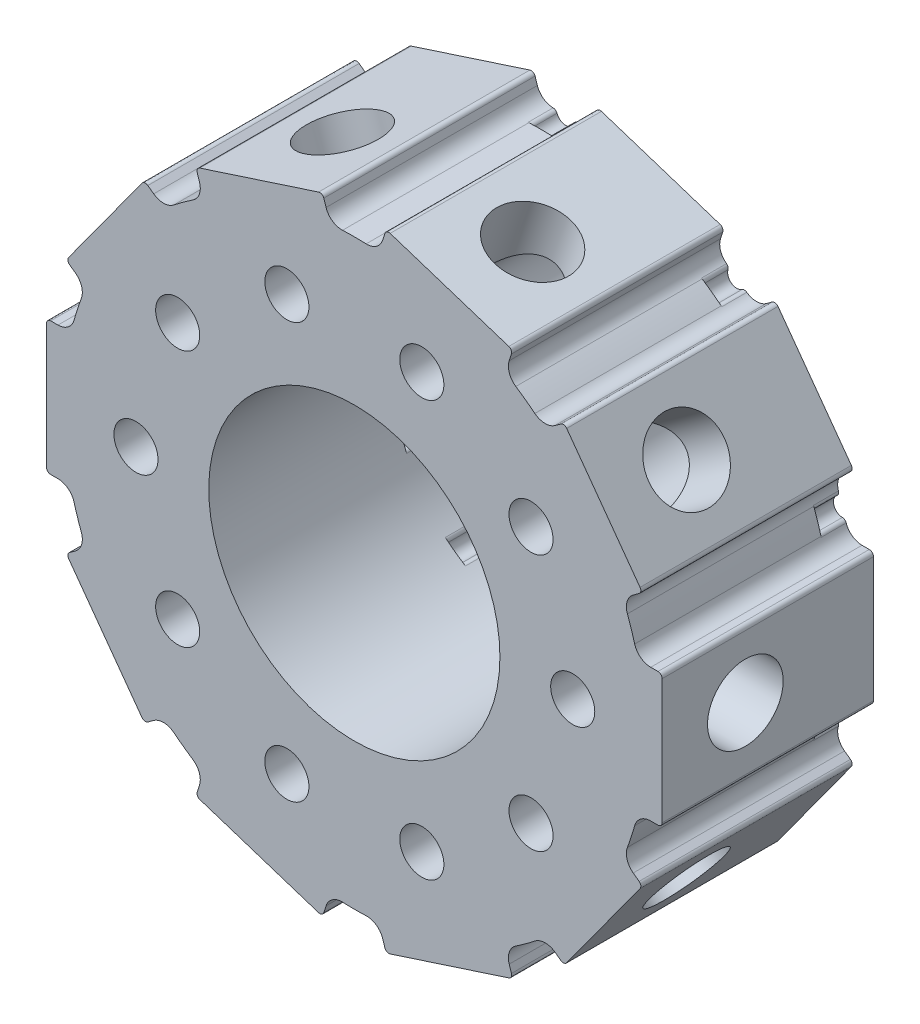
from build123d import *

# Parameters (mm, degrees)
SKETCH1_R                = 35
SKETCH1_R_2              = 17.5
BOSS_EXTRUDE1_DEPTH      = 25.4
M5_CLEARANCE_HOLE1_D     = 5.3
BOSS_EXTRUDE2_REACH      = 85.989
BOSS_EXTRUDE2_END_RADIUS = 35
SKETCH8_W                = 25.4
SKETCH8_H                = 16
FILLET3_R                = 2
FILLET4_R                = 0.5
CIRPATTERN3_COUNT        = 10
FILLET3_OF_CIRPATTERN3_R = 2
FILLET4_OF_CIRPATTERN3_R = 0.5
SKETCH9_R                = 1.1
CUT_EXTRUDE2_DEPTH       = 3
CIRPATTERN2_COUNT        = 10
FILLET1_R                = 0.5


with BuildPart() as part:
    # Sketch1 → Boss-Extrude1 (new body)
    with BuildSketch(Plane.XY):
        Circle(SKETCH1_R)
        Circle(SKETCH1_R_2, mode=Mode.SUBTRACT)
    extrude(amount=BOSS_EXTRUDE1_DEPTH)

    # M5 Clearance Hole1 (through all)
    with Locations(Plane.XY.offset(25.4)):
        with Locations((26.25, 0)):
            m5_clearance_hole1 = Hole(M5_CLEARANCE_HOLE1_D / 2)

    # Boss-Extrude2: up to this cylinder (the profile starts outside it)
    boss_extrude2_end = Plane(origin=(0, 0, 12.7), z_dir=(0, 0, -1)) * Cylinder(BOSS_EXTRUDE2_END_RADIUS, 242.978, mode=Mode.PRIVATE)
    # Sketch8 → Boss-Extrude2 (add, up to the surface)
    with BuildSketch(Plane(origin=(37, 0, 0), x_dir=(0, 0, -1), z_dir=(1, 0, 0)), mode=Mode.PRIVATE) as boss_extrude2_sk1:
        with Locations((-12.7, 0)):
            Rectangle(SKETCH8_W, SKETCH8_H)
    boss_extrude2_tool1 = extrude(boss_extrude2_sk1.sketch, amount=-BOSS_EXTRUDE2_REACH, mode=Mode.PRIVATE) - boss_extrude2_end
    boss_extrude2 = boss_extrude2_tool1.solids().sort_by_distance((37, 0, 12.7))[0]
    add(boss_extrude2)

    # Fillet3
    fillet3_edges = [part.edges().sort_by_distance(p)[0] for p in [
        (34.073450075, -8, 12.7),
        (34.073450075, 8, 12.7),
    ]]
    fillet(fillet3_edges, radius=FILLET3_R)

    # Fillet4
    fillet4_edges = [part.edges().sort_by_distance(p)[0] for p in [
        (37, -8, 12.7),
        (37, 8, 12.7),
    ]]
    fillet(fillet4_edges, radius=FILLET4_R)

    # Sketch11 → 1/8-27 NPSM Tapped Hole1 (revolve, cut)
    with BuildSketch(Plane(origin=(37, 0, 15.4), x_dir=(0, 0, -1), z_dir=(0, 1, 0))):
        Polygon((0, 0), (0, 12.73187289), (4.5466, 10), (4.5466, 0), align=None)
    f_1_8_27_npsm_tapped_hole1 = revolve(axis=Axis((43.35, 0, 15.4), (-1, 0, 0)), mode=Mode.SUBTRACT)

    # Sketch7 → Ø10.0mm Dowel Hole1 (revolve, cut)
    with BuildSketch(Plane.YZ.offset(26.25)):
        Polygon((0, 0), (0, 21.004303095), (5, 18), (5, 0), align=None)
    f_10_0mm_dowel_hole1 = revolve(axis=Axis((26.25, 0, -6.35), (0, 0, 1)), mode=Mode.SUBTRACT)

    # CirPattern3: M5 Clearance Hole1, Boss-Extrude2, 1/8-27 NPSM Tapped Hole1, Ø10.0mm Dowel Hole1 ×10 about axis
    cirpattern3_axis = Axis((0, 0, 0), (0, 0, 1))
    add([m5_clearance_hole1.rotate(cirpattern3_axis, i * 360 / CIRPATTERN3_COUNT) for i in range(1, CIRPATTERN3_COUNT)], mode=Mode.SUBTRACT)
    add([boss_extrude2.rotate(cirpattern3_axis, i * 360 / CIRPATTERN3_COUNT) for i in range(1, CIRPATTERN3_COUNT)])
    add([f_1_8_27_npsm_tapped_hole1.rotate(cirpattern3_axis, i * 360 / CIRPATTERN3_COUNT) for i in range(1, CIRPATTERN3_COUNT)], mode=Mode.SUBTRACT)
    add([f_10_0mm_dowel_hole1.rotate(cirpattern3_axis, i * 360 / CIRPATTERN3_COUNT) for i in range(1, CIRPATTERN3_COUNT)], mode=Mode.SUBTRACT)

    # Fillet3 of CirPattern3
    fillet3_of_cirpattern3_edges = [part.edges().sort_by_distance(p)[0] for p in [
        (32.268282186, 13.555735494, 12.7),
        (22.863718149, 26.500007404, 12.7),
        (18.13772726, 29.933640771, 12.7),
        (2.920823, 34.877912681, 12.7),
        (-2.920823, 34.877912681, 12.7),
        (-18.13772726, 29.933640771, 12.7),
        (-22.863718149, 26.500007404, 12.7),
        (-32.268282186, 13.555735494, 12.7),
        (-34.073450075, 8, 12.7),
        (-34.073450075, -8, 12.7),
        (-32.268282186, -13.555735494, 12.7),
        (-22.863718149, -26.500007404, 12.7),
        (-18.13772726, -29.933640771, 12.7),
        (-2.920823, -34.877912681, 12.7),
        (2.920823, -34.877912681, 12.7),
        (18.13772726, -29.933640771, 12.7),
        (22.863718149, -26.500007404, 12.7),
        (32.268282186, -13.555735494, 12.7),
    ]]
    fillet(fillet3_of_cirpattern3_edges, radius=FILLET3_OF_CIRPATTERN3_R)

    # Fillet4 of CirPattern3
    fillet4_of_cirpattern3_edges = [part.edges().sort_by_distance(p)[0] for p in [
        (34.63591081, 15.27591838, 12.7),
        (25.231346774, 28.22019029, 12.7),
        (19.042080922, 32.716955148, 12.7),
        (3.825176662, 37.661227058, 12.7),
        (-3.825176662, 37.661227058, 12.7),
        (-19.042080922, 32.716955148, 12.7),
        (-25.231346774, 28.22019029, 12.7),
        (-34.63591081, 15.27591838, 12.7),
        (-37, 8, 12.7),
        (-37, -8, 12.7),
        (-34.63591081, -15.27591838, 12.7),
        (-25.231346774, -28.22019029, 12.7),
        (-19.042080922, -32.716955148, 12.7),
        (-3.825176662, -37.661227058, 12.7),
        (3.825176662, -37.661227058, 12.7),
        (19.042080922, -32.716955148, 12.7),
        (25.231346774, -28.22019029, 12.7),
        (34.63591081, -15.27591838, 12.7),
    ]]
    fillet(fillet4_of_cirpattern3_edges, radius=FILLET4_OF_CIRPATTERN3_R)

    # Sketch9 → Cut-Extrude2 (cut)
    with BuildSketch(Plane.XY):
        with Locations((16.643489035, 5.407797402)):
            Circle(SKETCH9_R)
        with Locations((33.28697807, 10.815594803)):
            Circle(SKETCH9_R)
    cut_extrude2 = extrude(amount=CUT_EXTRUDE2_DEPTH, mode=Mode.SUBTRACT)

    # CirPattern2: Cut-Extrude2 ×10 about axis
    cirpattern2_axis = Axis((0, 0, 0), (0, 0, 1))
    for i in range(1, CIRPATTERN2_COUNT):
        add(cut_extrude2.rotate(cirpattern2_axis, i * 360 / CIRPATTERN2_COUNT), mode=Mode.SUBTRACT)

    # Fillet1
    # the kernel refuses this fillet: 0.5 mm, written as the material it takes off along each edge
    with BuildSketch(Plane(origin=(9.376442265, 14.776072904, 3), x_dir=(0.6816002712462033, 0.7317247229915785, 0), z_dir=(0, 0, -1)), Plane(origin=(-1.0994566, 17.465428571, 3), x_dir=(0.12132920189668266, 0.9926123235015339, 0), z_dir=(0, 0, -1)), Plane(origin=(-11.155400414, 13.483584153, 3), x_dir=(-0.4852854987496093, 0.8743557540860258, 0), z_dir=(0, 0, -1)), Plane(origin=(-16.950360427, 4.351468878, 3), x_dir=(-0.9065376331209773, 0.42212500486871957, 0), z_dir=(0, 0, -1)), Plane(origin=(-16.270858879, -6.442759607, 3), x_dir=(-0.9815232037209994, -0.1913431487074084, 0), z_dir=(0, 0, -1)), Plane(origin=(-9.376442265, -14.776072904, 3), x_dir=(-0.6816002712462165, -0.7317247229915662, 0), z_dir=(0, 0, -1)), Plane(origin=(1.0994566, -17.465428571, 3), x_dir=(-0.12132920189670673, -0.9926123235015311, 0), z_dir=(0, 0, -1)), Plane(origin=(16.270858879, 6.442759607, 3), x_dir=(0.9815232037210339, 0.19134314870723235, 0), z_dir=(0, 0, -1)), Plane(origin=(11.155400414, -13.483584153, 3), x_dir=(0.4852854987495814, -0.8743557540860413, 0), z_dir=(0, 0, -1)), Plane(origin=(16.950360427, -4.351468878, 3), x_dir=(0.9065376331210513, -0.4221250048685607, 0), z_dir=(0, 0, -1))) as fillet1_piece_1:
        with BuildLine():
            CenterArc((0.411657262, -0.494154385), FILLET1_R, 98.769841875, 69.35331945)
            ThreePointArc((-0.077638869, -0.391250078), (-0.037704674, -0.19584625), (0, 0))
            ThreePointArc((0, 0), (0.167712218, -0.012860353), (0.335424436, 0))
        make_face()
    extrude(amount=3.997197376, mode=Mode.SUBTRACT)
    with BuildSketch(Plane(origin=(11.155400414, 13.483584153, 3), x_dir=(0.4852854987497537, 0.8743557540859458, 0), z_dir=(0, 0, -1)), Plane(origin=(1.0994566, 17.465428571, 3), x_dir=(-0.12132920189668207, 0.9926123235015342, 0), z_dir=(0, 0, -1)), Plane(origin=(-9.376442265, 14.776072904, 3), x_dir=(-0.6816002712463332, 0.7317247229914574, 0), z_dir=(0, 0, -1)), Plane(origin=(-16.270858879, 6.442759607, 3), x_dir=(-0.9815232037210312, 0.19134314870724597, 0), z_dir=(0, 0, -1)), Plane(origin=(-16.950360427, -4.351468878, 3), x_dir=(-0.906537633121053, -0.4221250048685569, 0), z_dir=(0, 0, -1)), Plane(origin=(-11.155400414, -13.483584153, 3), x_dir=(-0.4852854987497482, -0.8743557540859487, 0), z_dir=(0, 0, -1)), Plane(origin=(-1.0994566, -17.465428571, 3), x_dir=(0.12132920189670673, -0.9926123235015311, 0), z_dir=(0, 0, -1)), Plane(origin=(16.950360427, 4.351468878, 3), x_dir=(0.9065376331209773, 0.42212500486871923, 0), z_dir=(0, 0, -1)), Plane(origin=(9.376442265, -14.776072904, 3), x_dir=(0.6816002712463544, -0.7317247229914378, 0), z_dir=(0, 0, -1)), Plane(origin=(16.270858879, -6.442759607, 3), x_dir=(0.9815232037210005, -0.19134314870740274, 0), z_dir=(0, 0, -1))) as fillet1_piece_2:
        with BuildLine():
            CenterArc((0.411657262, 0.494154385), FILLET1_R, 191.876838674, 69.35331945)
            ThreePointArc((-0.077638869, 0.391250078), (-0.037704674, 0.19584625), (0, 0))
            ThreePointArc((0, 0), (0.167712218, 0.012860353), (0.335424436, 0))
        make_face()
    extrude(amount=3.997197376, mode=Mode.SUBTRACT)
    with BuildSketch(Plane(origin=(19.672514733, -28.948094308, 3), x_dir=(-0.43636160508696165, 0.8997713874123419, 0), z_dir=(0, 0, -1)), Plane(origin=(-1.099864175, -34.982714286, 3), x_dir=(0.17584839774762118, 0.9844172596056991, 0), z_dir=(0, 0, -1)), Plane(origin=(-21.452132352, -27.655126425, 3), x_dir=(0.7208902895098397, 0.6930491977417039, 0), z_dir=(0, 0, -1)), Plane(origin=(-33.610415101, -9.764220233, 3), x_dir=(0.9905765928390418, 0.1369598982162126, 0), z_dir=(0, 0, -1)), Plane(origin=(-32.930661657, 11.856286215, 3), x_dir=(0.8818963061637765, -0.4714434273321528, 0), z_dir=(0, 0, -1)), Plane(origin=(-19.672514733, 28.948094308, 3), x_dir=(0.43636160508725247, -0.8997713874122009, 0), z_dir=(0, 0, -1)), Plane(origin=(1.099864175, 34.982714286, 3), x_dir=(-0.17584839774731933, -0.984417259605753, 0), z_dir=(0, 0, -1)), Plane(origin=(21.452132352, 27.655126425, 3), x_dir=(-0.7208902895098548, -0.6930491977416883, 0), z_dir=(0, 0, -1)), Plane(origin=(33.610415101, 9.764220233, 3), x_dir=(-0.9905765928390414, -0.13695989821621535, 0), z_dir=(0, 0, -1)), Plane(origin=(32.930661657, -11.856286215, 3), x_dir=(-0.8818963061637956, 0.471443427332117, 0), z_dir=(0, 0, -1))) as fillet1_piece_3:
        with BuildLine():
            CenterArc((0.43296463, -0.493529519), FILLET1_R, 99.227634076, 70.369044214)
            Line((-0.058815872, -0.403241436), (-0.107993922, -0.394212627))
            ThreePointArc((-0.107993922, -0.394212627), (-0.094018334, -0.307017149), (-0.049472853, 0.007241327))
            Line((-0.049472853, 0.007241327), (0.008017864, 0.049352952))
            ThreePointArc((0.008017864, 0.049352952), (0.176392997, 0.035764943), (0.344768131, 0.049352952))
            Line((0.344768131, 0.049352952), (0.352785995, 0))
        make_face()
    extrude(amount=4.018770589, mode=Mode.SUBTRACT)
    with BuildSketch(Plane(origin=(21.452132352, -27.655126425, 3), x_dir=(-0.7208902895098447, 0.6930491977416987, 0), z_dir=(0, 0, -1)), Plane(origin=(1.099864175, -34.982714286, 3), x_dir=(-0.17584839774762223, 0.9844172596056989, 0), z_dir=(0, 0, -1)), Plane(origin=(-19.672514733, -28.948094308, 3), x_dir=(0.43636160508695737, 0.8997713874123439, 0), z_dir=(0, 0, -1)), Plane(origin=(-32.930661657, -11.856286215, 3), x_dir=(0.8818963061637848, 0.47144342733213707, 0), z_dir=(0, 0, -1)), Plane(origin=(-33.610415101, 9.764220233, 3), x_dir=(0.9905765928390423, -0.1369598982162082, 0), z_dir=(0, 0, -1)), Plane(origin=(-21.452132352, 27.655126425, 3), x_dir=(0.720890289509619, -0.6930491977419337, 0), z_dir=(0, 0, -1)), Plane(origin=(-1.099864175, 34.982714286, 3), x_dir=(0.1758483977473177, -0.9844172596057533, 0), z_dir=(0, 0, -1)), Plane(origin=(19.672514733, 28.948094308, 3), x_dir=(-0.43636160508693694, -0.8997713874123539, 0), z_dir=(0, 0, -1)), Plane(origin=(32.930661657, 11.856286215, 3), x_dir=(-0.8818963061637848, -0.47144342733213707, 0), z_dir=(0, 0, -1)), Plane(origin=(33.610415101, -9.764220233, 3), x_dir=(-0.9905765928390389, 0.1369598982162329, 0), z_dir=(0, 0, -1))) as fillet1_piece_4:
        with BuildLine():
            CenterArc((0.43296463, 0.493529519), FILLET1_R, 190.40332171, 70.369044214)
            Line((-0.058815872, 0.403241436), (-0.107993922, 0.394212627))
            ThreePointArc((-0.107993922, 0.394212627), (-0.094018334, 0.307017149), (-0.049472853, -0.007241327))
            Line((-0.049472853, -0.007241327), (0.008017864, -0.049352952))
            ThreePointArc((0.008017864, -0.049352952), (0.176392997, -0.035764943), (0.344768131, -0.049352952))
            Line((0.344768131, -0.049352952), (0.352785995, 0))
        make_face()
    extrude(amount=4.018770589, mode=Mode.SUBTRACT)


solid = part.part
